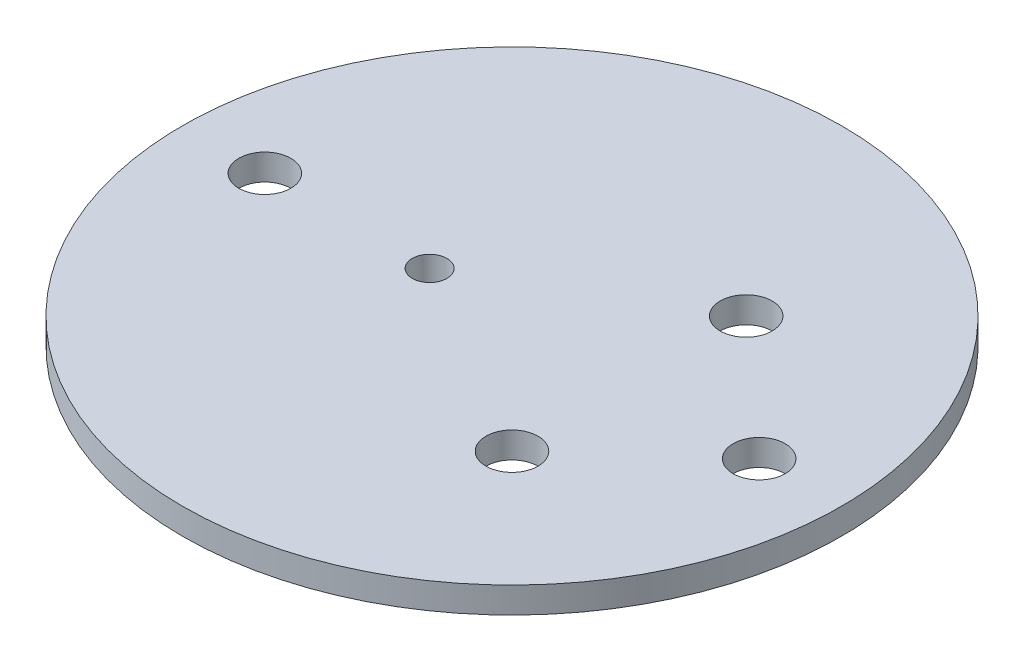
from build123d import *

# Parameters (mm, degrees)
SKETCH1_R           = 38
SKETCH1_R_2         = 3
SKETCH1_R_3         = 2
BOSS_EXTRUDE1_DEPTH = 3


with BuildPart() as part:
    # Sketch1 → Boss-Extrude1 (new body)
    with BuildSketch(Plane(origin=(0, 0, 0), x_dir=(1, 0, 0), z_dir=(0, 1, 0))):
        Circle(SKETCH1_R)
        with BuildLine():
            ThreePointArc((16.5, -13.5), (11.378679656, -15.621320344), (13.5, -10.5))
            ThreePointArc((13.5, -10.5), (15.621320344, -11.378679656), (16.5, -13.5))
        make_face(mode=Mode.SUBTRACT)
        with Locations((-28.5, 0)):
            Circle(SKETCH1_R_2, mode=Mode.SUBTRACT)
        with Locations((-9.5, 0)):
            Circle(SKETCH1_R_3, mode=Mode.SUBTRACT)
        with BuildLine():
            ThreePointArc((16.5, 13.5), (15.621320344, 11.378679656), (13.5, 10.5))
            ThreePointArc((13.5, 10.5), (11.378679656, 15.621320344), (16.5, 13.5))
        make_face(mode=Mode.SUBTRACT)
        with Locations((28.5, 0)):
            Circle(SKETCH1_R_2, mode=Mode.SUBTRACT)
    extrude(amount=-BOSS_EXTRUDE1_DEPTH)


solid = part.part
